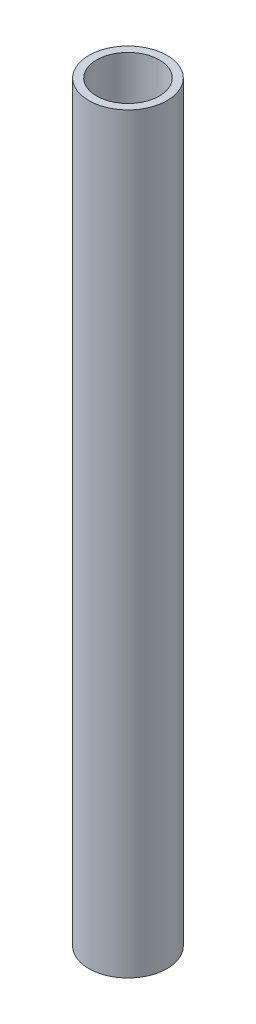
from build123d import *

# Parameters (mm, degrees)
TUBE_STOCK_EXTRUDE_DEPTH      = 152.4
TUBE_STOCK_EXTRUDE_DEPTH_BACK = 152.4
SKETCH2_R                     = 15.875
SKETCH2_R_2                   = 12.7


with BuildPart() as part:
    # Sketch2 → Tube Stock - Extrude (new, two sides: drawn at the far end of the back side and taken through both)
    with BuildSketch(Plane(origin=(0, 0, 0), x_dir=(1, 0, 0), z_dir=(0, 1, 0)).offset(-TUBE_STOCK_EXTRUDE_DEPTH_BACK)):
        Circle(SKETCH2_R)
        Circle(SKETCH2_R_2, mode=Mode.SUBTRACT)
    extrude(amount=TUBE_STOCK_EXTRUDE_DEPTH + TUBE_STOCK_EXTRUDE_DEPTH_BACK)


solid = part.part
